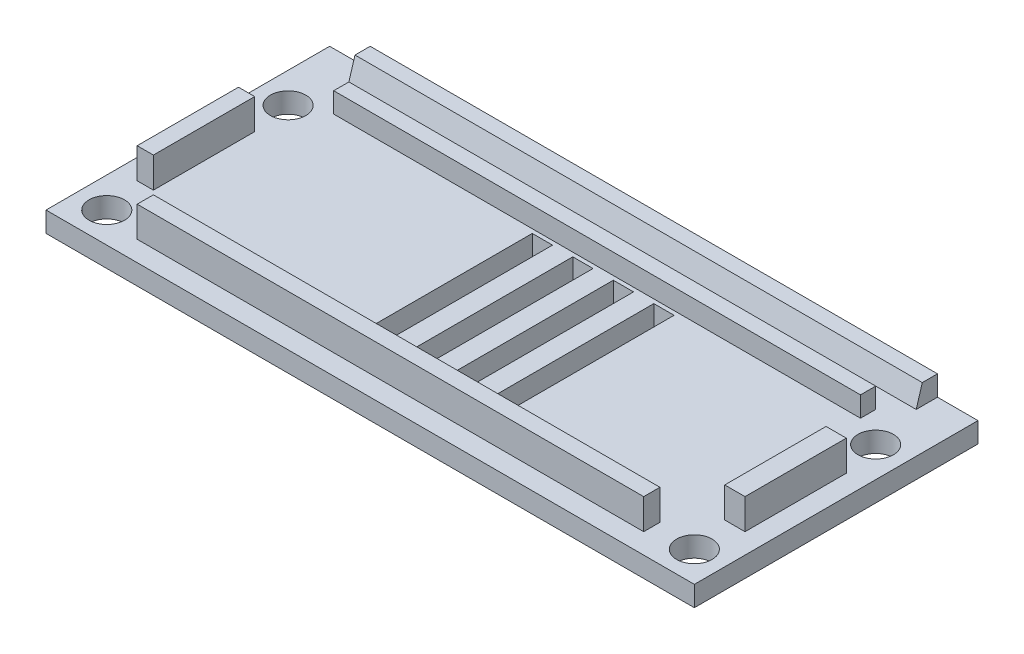
from build123d import *

# Parameters (mm, degrees)
SKIZZE1_W                       = 64
SKIZZE1_H                       = 28
AUFSATZ_LINEAR_AUSTRAGEN1_DEPTH = 2
SKIZZE2_R                       = 1.75
SCHNITT_LINEAR_AUSTRAGEN1_DEPTH = 70.885620839
SKIZZE3_W                       = 2
SKIZZE3_H                       = 16
SCHNITT_LINEAR_AUSTRAGEN2_DEPTH = 70.885620839
LINEARES_MUSTER1_COUNT          = 4
LINEARES_MUSTER1_PITCH          = 4
SKIZZE5_W                       = 1.6
SKIZZE5_H                       = 10
SKIZZE5_W_2                     = 50
SKIZZE5_H_2                     = 1.6
SKIZZE5_W_3                     = 2
AUFSATZ_LINEAR_AUSTRAGEN2_DEPTH = 3
SKIZZE6_W                       = 52
SKIZZE6_H                       = 1.5
AUFSATZ_LINEAR_AUSTRAGEN3_DEPTH = 2
SKIZZE7_W                       = 56
SKIZZE7_H                       = 2.1
AUFSATZ_LINEAR_AUSTRAGEN4_DEPTH = 2
FASE1_SIZE2                     = 0.6
FASE1_SIZE                      = 2


with BuildPart() as part:
    # Skizze1 → Aufsatz-Linear austragen1 (new body)
    with BuildSketch(Plane(origin=(0, 0, 0), x_dir=(1, 0, 0), z_dir=(0, 1, 0))):
        with Locations((32, 14)):
            Rectangle(SKIZZE1_W, SKIZZE1_H)
    extrude(amount=AUFSATZ_LINEAR_AUSTRAGEN1_DEPTH)

    # Skizze2 → Schnitt-Linear austragen1 (cut, through all)
    with BuildSketch(Plane(origin=(0, 2, 0), x_dir=(1, 0, 0), z_dir=(0, 1, 0))):
        with Locations(Location((3, 3, 0), (0, 0, 270))):
            Circle(SKIZZE2_R)
        with Locations(Location((3, 20.9, 0), (0, 0, 270))):
            Circle(SKIZZE2_R)
        with Locations(Location((61, 20.9, 0), (0, 0, 270))):
            Circle(SKIZZE2_R)
        with Locations(Location((61, 3, 0), (0, 0, 270))):
            Circle(SKIZZE2_R)
    extrude(amount=-SCHNITT_LINEAR_AUSTRAGEN1_DEPTH, mode=Mode.SUBTRACT)

    # Skizze3 → Schnitt-Linear austragen2 (cut, through all)
    with BuildSketch(Plane(origin=(0, 2, 0), x_dir=(1, 0, 0), z_dir=(0, 1, 0))):
        with Locations((27, 14)):
            Rectangle(SKIZZE3_W, SKIZZE3_H)
    schnitt_linear_austragen2 = extrude(amount=-SCHNITT_LINEAR_AUSTRAGEN2_DEPTH, mode=Mode.SUBTRACT)

    # Lineares Muster1: Schnitt-Linear austragen2 ×4
    with Locations(*[(i * LINEARES_MUSTER1_PITCH, 0, 0) for i in range(1, LINEARES_MUSTER1_COUNT)]):
        add(schnitt_linear_austragen2, mode=Mode.SUBTRACT)

    # Skizze5 → Aufsatz-Linear austragen2 (add)
    with BuildSketch(Plane(origin=(0, 2, 0), x_dir=(1, 0, 0), z_dir=(0, 1, 0))):
        with Locations((2.8, 12)):
            Rectangle(SKIZZE5_W, SKIZZE5_H)
        with Locations((32, 2.8)):
            Rectangle(SKIZZE5_W_2, SKIZZE5_H_2)
        with Locations((61, 12)):
            Rectangle(SKIZZE5_W_3, SKIZZE5_H)
    extrude(amount=AUFSATZ_LINEAR_AUSTRAGEN2_DEPTH)

    # Skizze6 → Aufsatz-Linear austragen3 (add)
    with BuildSketch(Plane(origin=(0, 2, 0), x_dir=(1, 0, 0), z_dir=(0, 1, 0))):
        with Locations((32, 23.15)):
            Rectangle(SKIZZE6_W, SKIZZE6_H)
    extrude(amount=AUFSATZ_LINEAR_AUSTRAGEN3_DEPTH)

    # Skizze7 → Aufsatz-Linear austragen4 (add)
    with BuildSketch(Plane(origin=(0, 2, 0), x_dir=(1, 0, 0), z_dir=(0, 1, 0))):
        with Locations((32, 26.95)):
            Rectangle(SKIZZE7_W, SKIZZE7_H)
    extrude(amount=AUFSATZ_LINEAR_AUSTRAGEN4_DEPTH)

    # Fase1
    fase1_edges = [part.edges().sort_by_distance(p)[0] for p in [
        (32, 4, -25.9),
    ]]
    fase1_side = [part.faces().sort_by_distance(p)[0] for p in [
        (32, 3.988, -25.9),
    ]]
    chamfer(fase1_edges, length=FASE1_SIZE - 0.0001, length2=FASE1_SIZE2 - 0.0001, reference=fase1_side[0])  # a hair under: the kernel refuses the full size


solid = part.part
